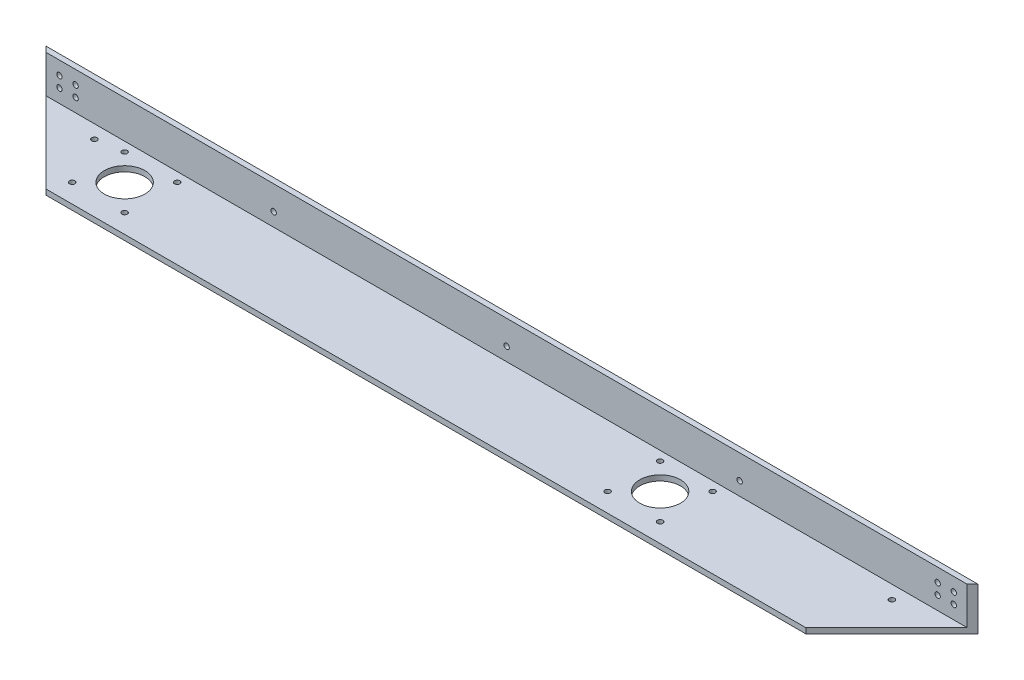
from build123d import *

# Parameters (mm, degrees)
BOSS_EXTRUDE1_DEPTH              = 550
CHAMFER7_SIZE                    = 50.8
CHAMFER8_SIZE                    = 50.8
BOTTHOMHOLES_SKETCH2_R           = 12
BOTTHOMHOLES_SKETCH2_R_2         = 1.5875
BOTTOMHOLES_CUT_EXTRUDE1_DEPTH   = 553.788015993
LEFTSIDEHOLES_SKETCH3_R          = 1.5875
LEFTSIDEHOLES_CUT_EXTRUDE2_DEPTH = 553.924768843


with BuildPart() as part:
    # Sketch1 → Boss-Extrude1 (new body)
    with BuildSketch(Plane(origin=(0, 0, 0), x_dir=(0, 0, -1), z_dir=(1, 0, 0))):
        Polygon((0, 0), (-50.8, 0), (-50.8, 3.175), (-3.175, 3.175), (-3.175, 25.4), (0, 25.4), align=None)
    extrude(amount=BOSS_EXTRUDE1_DEPTH)

    # Chamfer7
    chamfer7_edges = [part.edges().sort_by_distance(p)[0] for p in [
        (0, 1.5875, 50.8),
    ]]
    chamfer(chamfer7_edges, length=CHAMFER7_SIZE - 0.0001)  # a hair under: the kernel refuses the full size

    # Chamfer8
    chamfer8_edges = [part.edges().sort_by_distance(p)[0] for p in [
        (550, 1.5875, 50.8),
    ]]
    chamfer(chamfer8_edges, length=CHAMFER8_SIZE - 0.0001)  # a hair under: the kernel refuses the full size

    # BotthomHoles-Sketch2 → BottomHoles-Cut-Extrude1 (cut, through all)
    with BuildSketch(Plane(origin=(0, 3.175, 0), x_dir=(1, 0, 0), z_dir=(0, 1, 0))):
        with Locations(Location((70.575, -24.175, 0), (0, 0, 270))):
            Circle(BOTTHOMHOLES_SKETCH2_R)
        with Locations(Location((386.575, -24.175, 0), (0, 0, 270))):
            Circle(BOTTHOMHOLES_SKETCH2_R)
        with Locations(Location((55.075, -8.675, 0), (0, 0, 270))):
            Circle(BOTTHOMHOLES_SKETCH2_R_2)
        with Locations(Location((86.075, -8.675, 0), (0, 0, 270))):
            Circle(BOTTHOMHOLES_SKETCH2_R_2)
        with Locations(Location((371.075, -8.675, 0), (0, 0, 270))):
            Circle(BOTTHOMHOLES_SKETCH2_R_2)
        with Locations(Location((402.075, -8.675, 0), (0, 0, 270))):
            Circle(BOTTHOMHOLES_SKETCH2_R_2)
        with Locations(Location((55.075, -39.675, 0), (0, 0, 270))):
            Circle(BOTTHOMHOLES_SKETCH2_R_2)
        with Locations(Location((86.075, -39.675, 0), (0, 0, 270))):
            Circle(BOTTHOMHOLES_SKETCH2_R_2)
        with Locations(Location((371.075, -39.675, 0), (0, 0, 270))):
            Circle(BOTTHOMHOLES_SKETCH2_R_2)
        with Locations(Location((402.075, -39.675, 0), (0, 0, 270))):
            Circle(BOTTHOMHOLES_SKETCH2_R_2)
        with Locations(Location((39.6875, -11.1125, 0), (0, 0, 270))):
            Circle(BOTTHOMHOLES_SKETCH2_R_2)
        with Locations(Location((510.3125, -11.1125, 0), (0, 0, 270))):
            Circle(BOTTHOMHOLES_SKETCH2_R_2)
    extrude(amount=-BOTTOMHOLES_CUT_EXTRUDE1_DEPTH, mode=Mode.SUBTRACT)

    # LeftSideHoles-Sketch3 → LeftSideHoles-Cut-Extrude2 (cut, through all)
    with BuildSketch(Plane(origin=(0, 0, 0), x_dir=(-1, 0, 0), z_dir=(0, 0, -1))):
        with Locations(Location((-538.8875, 17.4625, 0), (0, 0, 90))):
            Circle(LEFTSIDEHOLES_SKETCH3_R)
        with Locations(Location((-529.3625, 17.4625, 0), (0, 0, 90))):
            Circle(LEFTSIDEHOLES_SKETCH3_R)
        with Locations(Location((-538.8875, 11.1125, 0), (0, 0, 90))):
            Circle(LEFTSIDEHOLES_SKETCH3_R)
        with Locations(Location((-529.3625, 11.1125, 0), (0, 0, 90))):
            Circle(LEFTSIDEHOLES_SKETCH3_R)
        with Locations(Location((-11.1125, 11.1125, 0), (0, 0, 90))):
            Circle(LEFTSIDEHOLES_SKETCH3_R)
        with Locations(Location((-20.6375, 11.1125, 0), (0, 0, 90))):
            Circle(LEFTSIDEHOLES_SKETCH3_R)
        with Locations(Location((-20.6375, 17.4625, 0), (0, 0, 90))):
            Circle(LEFTSIDEHOLES_SKETCH3_R)
        with Locations(Location((-11.1125, 17.4625, 0), (0, 0, 90))):
            Circle(LEFTSIDEHOLES_SKETCH3_R)
        with Locations(Location((-412.5, 11.1125, 0), (0, 0, 90))):
            Circle(LEFTSIDEHOLES_SKETCH3_R)
        with Locations(Location((-275, 11.1125, 0), (0, 0, 90))):
            Circle(LEFTSIDEHOLES_SKETCH3_R)
        with Locations(Location((-137.5, 11.1125, 0), (0, 0, 90))):
            Circle(LEFTSIDEHOLES_SKETCH3_R)
    extrude(amount=-LEFTSIDEHOLES_CUT_EXTRUDE2_DEPTH, mode=Mode.SUBTRACT)


solid = part.part
